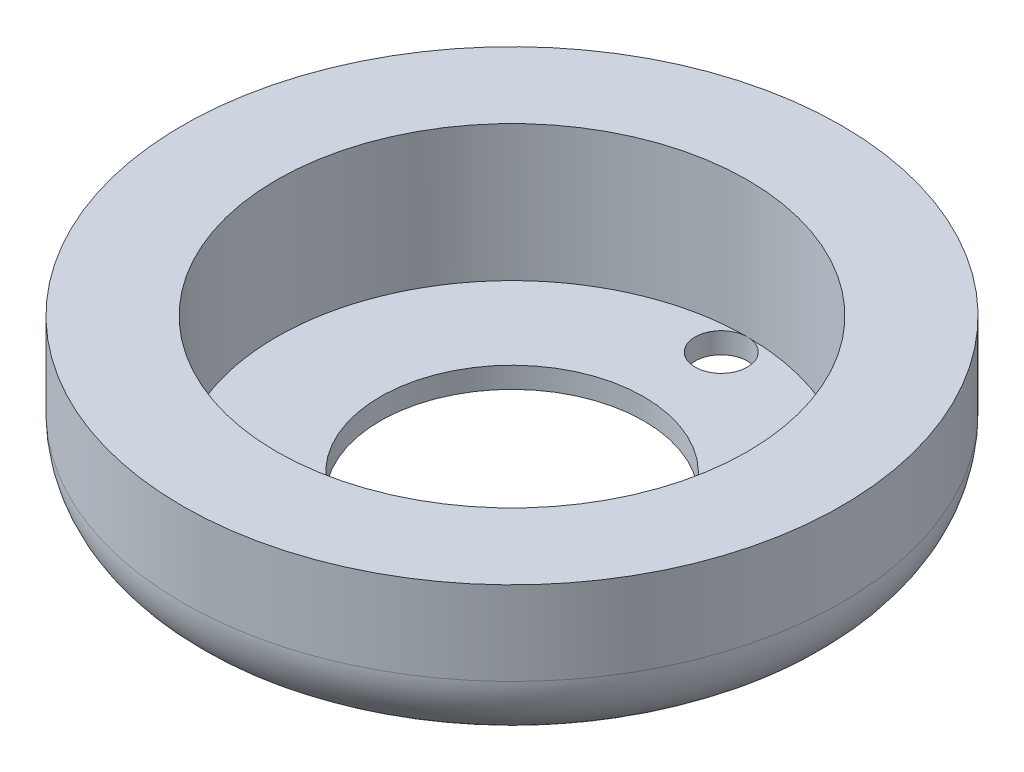
from build123d import *

# Parameters (mm, degrees)
SKETCH1_R           = 31.5
BOSS_EXTRUDE1_DEPTH = 15
SKETCH2_R           = 22.5
CUT_EXTRUDE1_DEPTH  = 13
SKETCH3_R           = 12.6
SKETCH3_R_2         = 2.5
CUT_EXTRUDE2_DEPTH  = 13
FILLET1_R           = 7


with BuildPart() as part:
    # Sketch1 → Boss-Extrude1 (new body)
    with BuildSketch(Plane(origin=(0, 0, 0), x_dir=(1, 0, 0), z_dir=(0, 1, 0))):
        Circle(SKETCH1_R)
    extrude(amount=BOSS_EXTRUDE1_DEPTH)

    # Sketch2 → Cut-Extrude1 (cut)
    with BuildSketch(Plane(origin=(0, 15, 0), x_dir=(1, 0, 0), z_dir=(0, 1, 0))):
        Circle(SKETCH2_R)
    extrude(amount=-CUT_EXTRUDE1_DEPTH, mode=Mode.SUBTRACT)

    # Sketch3 → Cut-Extrude2 (cut)
    with BuildSketch(Plane.XZ):
        Circle(SKETCH3_R)
        with Locations((0, 20)):
            Circle(SKETCH3_R_2)
        with Locations((0, -20)):
            Circle(SKETCH3_R_2)
    extrude(amount=-CUT_EXTRUDE2_DEPTH, mode=Mode.SUBTRACT)

    # Fillet1
    fillet1_edges = [part.edges().sort_by_distance(p)[0] for p in [
        (-31.5, 0, 0),
    ]]
    fillet(fillet1_edges, radius=FILLET1_R)


solid = part.part
